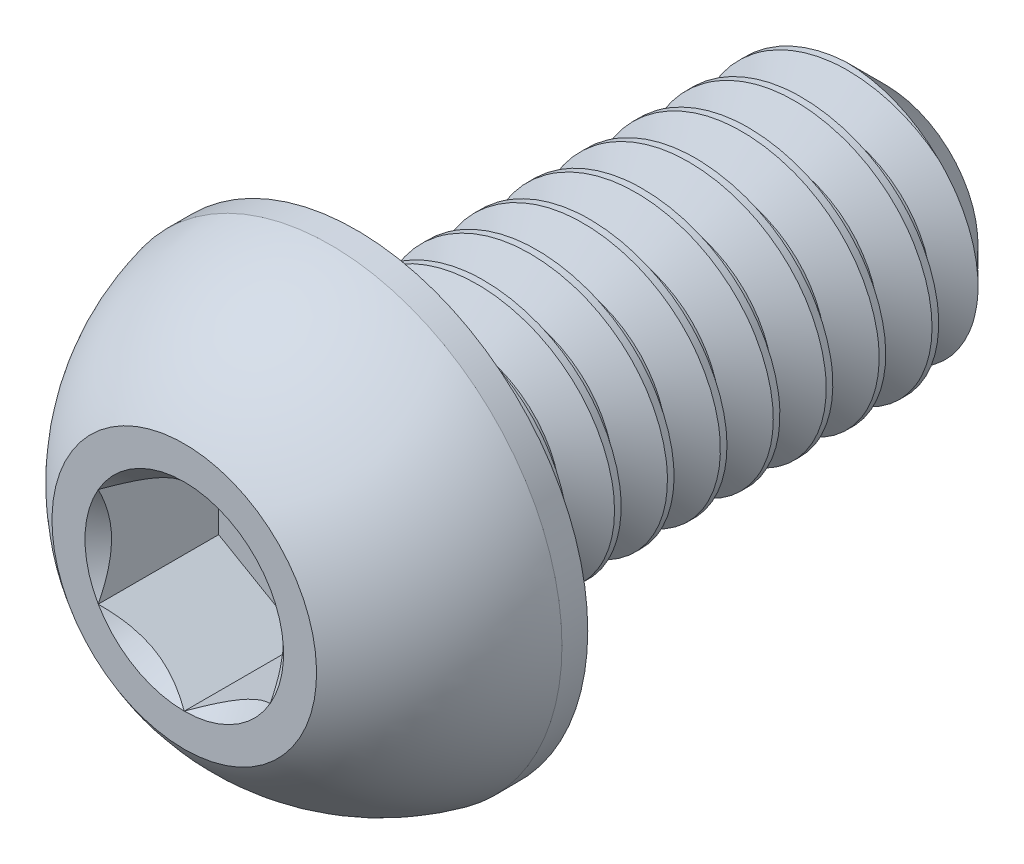
from build123d import *

# Parameters (mm, degrees)
SKETCH1_W          = 4
SKETCH1_H          = 1
CHAMFER1_SIZE      = 0.3
CUT_EXTRUDE2_DEPTH = 0.91
CUT_SWEEP1_PITCH   = 0.4


with BuildPart() as part:
    # Sketch1 → Revolve1 (revolve)
    with BuildSketch(Plane(origin=(0, 0, 0), x_dir=(0, 0, -1), z_dir=(1, 0, 0))):
        with Locations((3.3, 0.5)):
            Rectangle(SKETCH1_W, SKETCH1_H)
    revolve(axis=Axis((0, 0, -5.3), (0, 0, 1)))

    # Chamfer1
    chamfer1_edges = [part.edges().sort_by_distance(p)[0] for p in [
        (0, -1, -5.3),
    ]]
    chamfer(chamfer1_edges, length=CHAMFER1_SIZE)

    # Sketch7 → Revolve2 (revolve)
    with BuildSketch(Plane(origin=(0, 0, 0), x_dir=(0, 0, -1), z_dir=(1, 0, 0)), mode=Mode.PRIVATE) as revolve2_sk:
        with BuildLine():
            Line((1.105, 1.75), (1.3, 1.75))
            Line((1.3, 1.75), (1.3, 0))
            Line((1.3, 0), (0, 0))
            Line((0, 0), (0, 1))
            ThreePointArc((0, 1), (0.479976957, 1.481850617), (1.105, 1.75))
        make_face()
    revolve(revolve2_sk.sketch.rotate(Axis((0, 0, 0), (0, 0, -1)), 180), axis=Axis((0, 0, 0), (0, 0, -1)))

    # Sketch5 → Cut-Extrude2 (cut)
    with BuildSketch(Plane.XY):
        Polygon((0.65, -0.375277675), (0.65, 0.375277675), (0, 0.75055535), (-0.65, 0.375277675), (-0.65, -0.375277675), (0, -0.75055535), align=None)
    extrude(amount=-CUT_EXTRUDE2_DEPTH, mode=Mode.SUBTRACT)

    # Cut-Extrude3 cone 1 section (through the dimple's axis) → Cut-Extrude3 (revolve, cut)
    with BuildSketch(Plane(origin=(0, 0, 0), x_dir=(0, -1, 0), z_dir=(1, 0, 0))):
        Polygon((0, 0), (0.75055535, 0), (0, 0.75055535), align=None)
    revolve(axis=Axis((0, 0, 0), (0, 0, -1)), mode=Mode.SUBTRACT)

    # Cut-Sweep1: the profile of Sketch2 profile screwed along a right-hand helix of 11 turns, 6 arcs to a turn; built about Z, then put on its axis
    cut_sweep1_z = Axis((0, 0, 0), (0, 0, 1))
    cut_sweep1_corners = [(1.0003, 0, 0.300173205), (1.0003, 0, -0.050173205), (0.740192379, 0, 0.1), (0.740192379, 0, 0.15)]
    with BuildLine(mode=Mode.PRIVATE) as cut_sweep1_profile:
        Line(cut_sweep1_corners[0], cut_sweep1_corners[1])
        Line(cut_sweep1_corners[1], cut_sweep1_corners[2])
        Line(cut_sweep1_corners[2], cut_sweep1_corners[3])
        Line(cut_sweep1_corners[3], cut_sweep1_corners[0])
    cut_sweep1_cap = Face(cut_sweep1_profile.wire())
    cut_sweep1_turn_angles = [0, 30, 60, 90, 120, 150, 180, 210, 240, 270, 300, 330, 360]
    cut_sweep1_turn_weights = [1, 0.8660254037844387, 1, 0.8660254037844387, 1, 0.8660254037844387, 1, 0.8660254037844387, 1, 0.8660254037844387, 1, 0.8660254037844387, 1]
    cut_sweep1_turn_rails = [Edge.make_bspline([Vector(p[0], p[1], 0).rotate(cut_sweep1_z, cut_sweep1_turn_angles[k]) / cut_sweep1_turn_weights[k] + Vector(0, 0, p[2] + CUT_SWEEP1_PITCH * cut_sweep1_turn_angles[k] / 360) for k in range(13)], [0, 0, 0, 1, 1, 2, 2, 3, 3, 4, 4, 5, 5, 6, 6, 6], 2, cut_sweep1_turn_weights) for p in cut_sweep1_corners]
    cut_sweep1_turn_sides = [Face.make_surface_from_curves(cut_sweep1_turn_rails[p[0]], cut_sweep1_turn_rails[p[1]]) for p in [(0, 1), (1, 2), (2, 3), (3, 0)]]
    cut_sweep1 = Plane(origin=(0, 0, -5.3), x_dir=(0, 1, 0), z_dir=(0, 0, 1)) * Solid(Shell([*[p.moved(Location((0, 0, CUT_SWEEP1_PITCH * i))) for i in range(11) for p in cut_sweep1_turn_sides], cut_sweep1_cap, cut_sweep1_cap.rotate(cut_sweep1_z, 3960).moved(Location((0, 0, CUT_SWEEP1_PITCH * 3960 / 360)))]))
    add(cut_sweep1, mode=Mode.SUBTRACT)


solid = part.part
